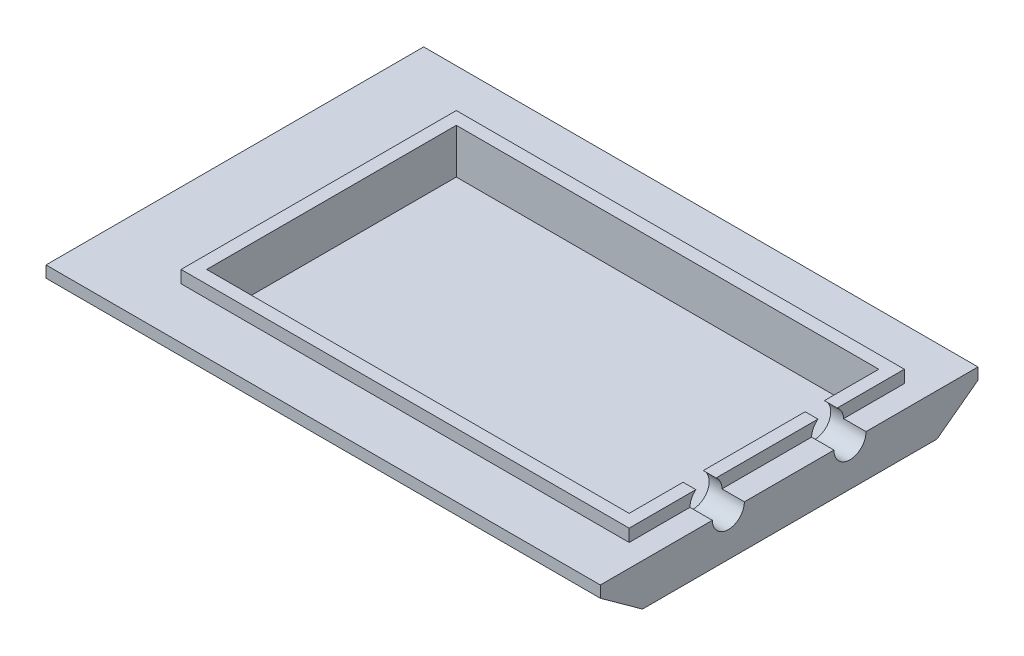
from build123d import *

# Parameters (mm, degrees)
SKETCH2_2_W         = 219.964
SKETCH2_2_H         = 149.86
BOSS_EXTRUDE2_DEPTH = 4.572
SKETCH3_W           = 177.8
SKETCH3_H           = 109.22
BOSS_EXTRUDE3_DEPTH = 5.08
SKETCH4_W           = 167.64
SKETCH4_H           = 99.06
CUT_EXTRUDE1_DEPTH  = 258.8719036
SKETCH4_2_W         = 167.64
SKETCH4_2_H         = 99.06
CUT_EXTRUDE2_DEPTH  = 12.7
SKETCH5_R           = 6.35
CUT_EXTRUDE3_DEPTH  = 19.05


with BuildPart() as part:
    # Sketch2 → Loft1 section 0
    with BuildSketch(Plane(origin=(0, 12.0904, 0), x_dir=(1, 0, 0), z_dir=(0, 1, 0))):
        with BuildLine():
            Line((-219.964, 16.289130435), (0, 16.289130435))
            Line((0, 16.289130435), (0, -133.570869565))
            Line((0, -133.570869565), (-219.964, -133.570869565))
            Line((-219.964, -133.570869565), (-219.964, 16.289130435))
        make_face()
    # Sketch1 → Loft1 section 1
    with BuildSketch(Plane(origin=(0, 0, 0), x_dir=(1, 0, 0), z_dir=(0, 1, 0))):
        with BuildLine():
            Line((-190.5, 0), (0, 0))
            Line((0, 0), (0, -116.84))
            Line((0, -116.84), (-190.5, -116.84))
            Line((-190.5, -116.84), (-190.5, 0))
        make_face()
    loft()

    # Sketch2<2> → Boss-Extrude2 (add)
    with BuildSketch(Plane(origin=(0, 12.0904, 0), x_dir=(1, 0, 0), z_dir=(0, 1, 0))):
        with Locations((-109.982, -58.640869565)):
            Rectangle(SKETCH2_2_W, SKETCH2_2_H)
    extrude(amount=BOSS_EXTRUDE2_DEPTH)

    # Sketch3 → Boss-Extrude3 (add)
    with BuildSketch(Plane(origin=(0, 16.51, 0), x_dir=(1, 0, 0), z_dir=(0, 1, 0))):
        with Locations((-97.79, -58.640869565)):
            Rectangle(SKETCH3_W, SKETCH3_H)
    extrude(amount=BOSS_EXTRUDE3_DEPTH)

    # Sketch4 → Cut-Extrude1 (cut, through all)
    with BuildSketch(Plane(origin=(0, 16.51, 0), x_dir=(1, 0, 0), z_dir=(0, 1, 0))):
        with Locations((-97.79, -58.640869565)):
            Rectangle(SKETCH4_W, SKETCH4_H)
    extrude(amount=CUT_EXTRUDE1_DEPTH, mode=Mode.SUBTRACT)

    # Sketch4<2> → Cut-Extrude2 (cut)
    with BuildSketch(Plane(origin=(0, 16.51, 0), x_dir=(1, 0, 0), z_dir=(0, 1, 0))):
        with Locations((-97.79, -58.640869565)):
            Rectangle(SKETCH4_2_W, SKETCH4_2_H)
    extrude(amount=-CUT_EXTRUDE2_DEPTH, mode=Mode.SUBTRACT)

    # Sketch5 → Cut-Extrude3 (cut)
    with BuildSketch(Plane(origin=(0, 0, 0), x_dir=(0, 0, -1), z_dir=(1, 0, 0))):
        with Locations((-82.770869565, 16.6624)):
            Circle(SKETCH5_R)
        with Locations((-34.510869565, 16.51)):
            Circle(SKETCH5_R)
    extrude(amount=-CUT_EXTRUDE3_DEPTH, mode=Mode.SUBTRACT)


solid = part.part
